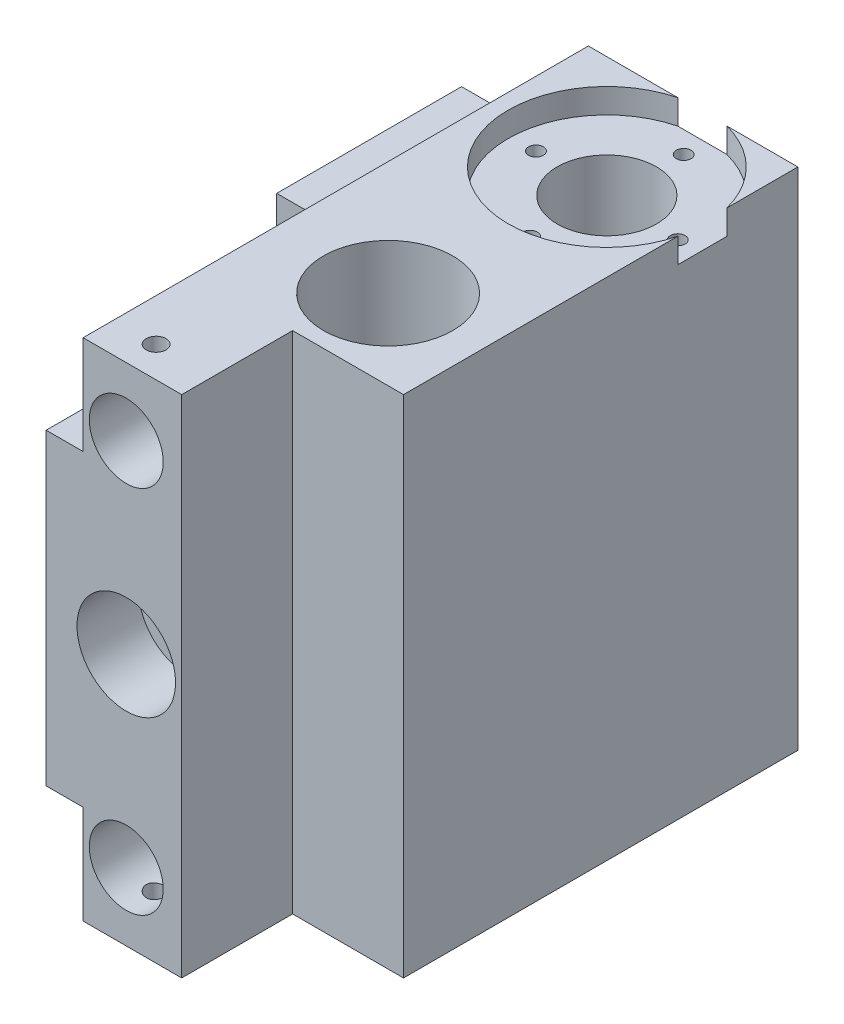
from build123d import *
from build123d.topology import SkipClean

# Parameters (mm, degrees)
SKETCH1_W           = 40
SKETCH1_H           = 82
SKETCH1_R           = 5.5
SKETCH1_R_2         = 6
BOSS_EXTRUDE1_DEPTH = 12
BOSS_EXTRUDE2_START = 70
SKETCH2_W           = 40
SKETCH2_H           = 82
SKETCH2_R           = 5.5
BOSS_EXTRUDE2_DEPTH = 70
SKETCH3_R           = 1.6
CUT_EXTRUDE1_DEPTH  = 10
CUT_EXTRUDE2_START  = -10
SKETCH4_R           = 1.6
CUT_EXTRUDE2_DEPTH  = 10
SKETCH5_R           = 10.5
SKETCH5_R_2         = 5.5
CUT_EXTRUDE3_DEPTH  = 100
SKETCH6_R           = 16
CUT_EXTRUDE4_DEPTH  = 4
SKETCH19_R          = 8.05
CUT_EXTRUDE17_DEPTH = 16
SKETCH12_R          = 1.2
CUT_EXTRUDE12_DEPTH = 12
SKETCH13_W          = 20
SKETCH13_H          = 70
BOSS_EXTRUDE3_DEPTH = 30
CUT_EXTRUDE14_DEPTH = 115
SKETCH20_W          = 18
SKETCH20_H          = 18
CUT_EXTRUDE18_DEPTH = 100
SKETCH21_R          = 8
CUT_EXTRUDE19_DEPTH = 10


with BuildPart() as part:
    # Sketch1 → Boss-Extrude1 (new body)
    with BuildSketch(Plane.XY):
        with Locations((-20, -41)):
            Rectangle(SKETCH1_W, SKETCH1_H)
        with Locations((-27, -41)):
            Circle(SKETCH1_R, mode=Mode.SUBTRACT)
        with Locations((-27, -11)):
            Circle(SKETCH1_R_2, mode=Mode.SUBTRACT)
        with Locations((-27, -71)):
            Circle(SKETCH1_R_2, mode=Mode.SUBTRACT)
    extrude(amount=BOSS_EXTRUDE1_DEPTH)

    # Sketch2 → Boss-Extrude2 (add)
    with SkipClean():  # the faces are left unmerged after this step: merging them gives an invalid solid
        with BuildSketch(Plane(origin=(0, 0, 0), x_dir=(-1, 0, 0), z_dir=(0, 0, -1)).offset(BOSS_EXTRUDE2_START)):
            with Locations((20, -41)):
                Rectangle(SKETCH2_W, SKETCH2_H)
            with Locations((27, -41)):
                Circle(SKETCH2_R, mode=Mode.SUBTRACT)
        extrude(amount=-BOSS_EXTRUDE2_DEPTH)

    # Sketch3 → Cut-Extrude1 (cut)
    with SkipClean():  # the faces are left unmerged after this step: merging them gives an invalid solid
        with BuildSketch(Plane(origin=(0, 0, 0), x_dir=(1, 0, 0), z_dir=(0, 1, 0))):
            with Locations((-27.154767421, -7)):
                Circle(SKETCH3_R)
        extrude(amount=-CUT_EXTRUDE1_DEPTH, mode=Mode.SUBTRACT)

    # Sketch4 → Cut-Extrude2 (cut)
    with SkipClean():  # the faces are left unmerged after this step: merging them gives an invalid solid
        with BuildSketch(Plane.XZ.offset(82).offset(CUT_EXTRUDE2_START)):
            with Locations((-27.154767421, 7)):
                Circle(SKETCH4_R)
        extrude(amount=CUT_EXTRUDE2_DEPTH, mode=Mode.SUBTRACT)

    # Sketch5 → Cut-Extrude3 (cut)
    with SkipClean():  # the faces are left unmerged after this step: merging them gives an invalid solid
        with BuildSketch(Plane(origin=(0, 0, 0), x_dir=(1, 0, 0), z_dir=(0, 1, 0))):
            with Locations((-15.5, 19)):
                Circle(SKETCH5_R)
            with Locations((-15.5, 54.5)):
                Circle(SKETCH5_R_2)
        extrude(amount=-CUT_EXTRUDE3_DEPTH, mode=Mode.SUBTRACT)

    # Sketch6 → Cut-Extrude4 (cut)
    with SkipClean():  # the faces are left unmerged after this step: merging them gives an invalid solid
        with BuildSketch(Plane(origin=(0, 0, 0), x_dir=(1, 0, 0), z_dir=(0, 1, 0))):
            with Locations((-15.5, 54.5)):
                Circle(SKETCH6_R)
        extrude(amount=-CUT_EXTRUDE4_DEPTH, mode=Mode.SUBTRACT)

    # Sketch19 → Cut-Extrude17 (cut)
    with SkipClean():  # the faces are left unmerged after this step: merging them gives an invalid solid
        with BuildSketch(Plane(origin=(0, -4, 0), x_dir=(1, 0, 0), z_dir=(0, 1, 0))):
            with Locations((-15.5, 54.5)):
                Circle(SKETCH19_R)
        extrude(amount=-CUT_EXTRUDE17_DEPTH, mode=Mode.SUBTRACT)

    # Sketch12 → Cut-Extrude12 (cut)
    with SkipClean():  # the faces are left unmerged after this step: merging them gives an invalid solid
        with BuildSketch(Plane(origin=(0, -4, 0), x_dir=(1, 0, 0), z_dir=(0, 1, 0))):
            with Locations((-15.98192958, 42.509681244)):
                Circle(SKETCH12_R)
            with Locations((-3.509681244, 54.01807042)):
                Circle(SKETCH12_R)
            with Locations((-15.01807042, 66.490318756)):
                Circle(SKETCH12_R)
            with Locations((-27.490318756, 54.98192958)):
                Circle(SKETCH12_R)
        extrude(amount=-CUT_EXTRUDE12_DEPTH, mode=Mode.SUBTRACT)

    # Sketch13 → Boss-Extrude3 (add)
    with SkipClean():  # the faces are left unmerged after this step: merging them gives an invalid solid
        with BuildSketch(Plane(origin=(0, 0, -70), x_dir=(-1, 0, 0), z_dir=(0, 0, -1))):
            with Locations((50, -35)):
                Rectangle(SKETCH13_W, SKETCH13_H)
        extrude(amount=-BOSS_EXTRUDE3_DEPTH)

    # Sketch15 → Cut-Extrude14 (cut)
    with SkipClean():  # the faces are left unmerged after this step: merging them gives an invalid solid
        with BuildSketch(Plane(origin=(0, 0, -70), x_dir=(-1, 0, 0), z_dir=(0, 0, -1))):
            Polygon((34, 0), (34, -16), (54.581085422, -16), (54.581085422, -66), (34, -66), (34, -82), (77.520554958, -82), (77.520554958, 0), align=None)
        extrude(amount=-CUT_EXTRUDE14_DEPTH, mode=Mode.SUBTRACT)

    # Sketch20 → Cut-Extrude18 (cut)
    with SkipClean():  # the faces are left unmerged after this step: merging them gives an invalid solid
        with BuildSketch(Plane.XZ.offset(82)):
            with Locations((-9, 3)):
                Rectangle(SKETCH20_W, SKETCH20_H)
        extrude(amount=-CUT_EXTRUDE18_DEPTH, mode=Mode.SUBTRACT)

    # Sketch21 → Cut-Extrude19 (cut)
    with SkipClean():  # the faces are left unmerged after this step: merging them gives an invalid solid
        with BuildSketch(Plane.XY.offset(12)):
            with Locations((-27, -41)):
                Circle(SKETCH21_R)
        extrude(amount=-CUT_EXTRUDE19_DEPTH, mode=Mode.SUBTRACT)


solid = part.part
